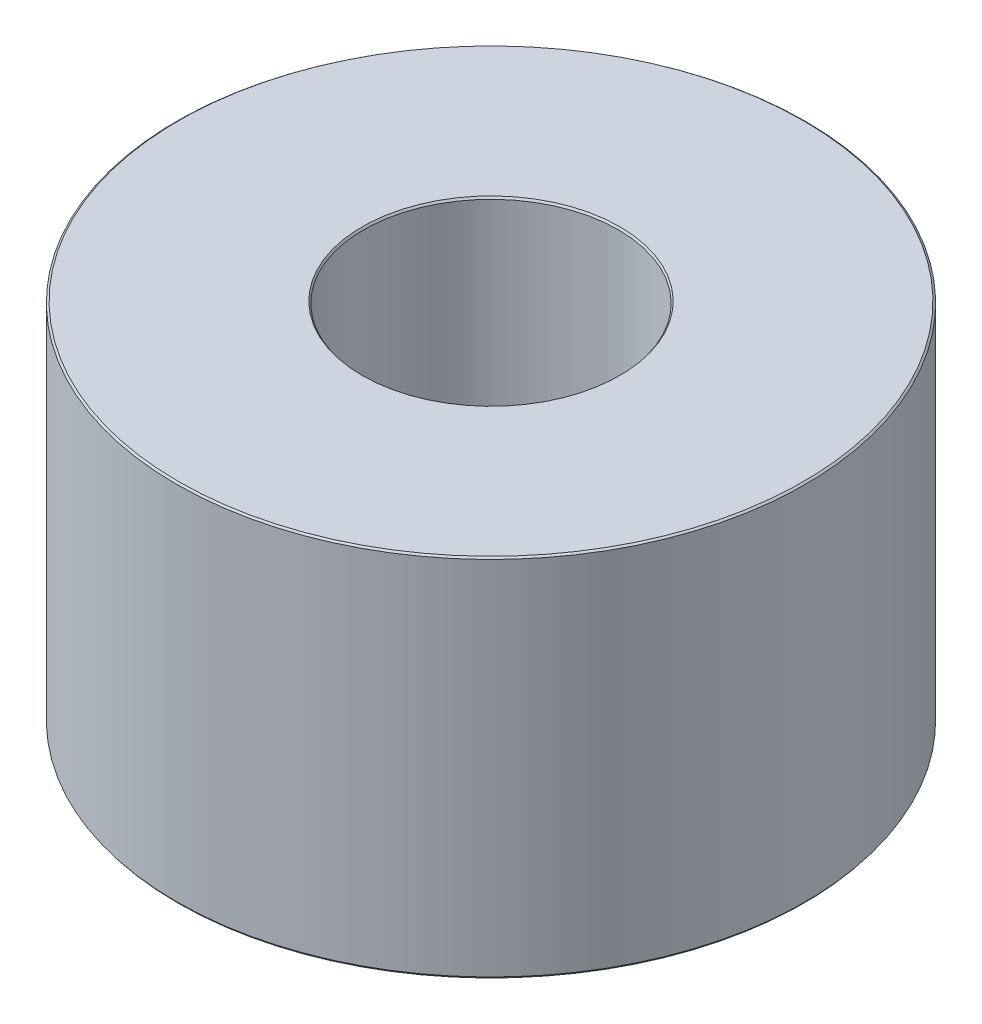
from build123d import *
from OCP.BRepFilletAPI import BRepFilletAPI_MakeChamfer

# Parameters (mm, degrees)
SKETCH1_R           = 47.5
BOSS_EXTRUDE1_DEPTH = 55.128628039
SKETCH2_R           = 19.250510028
CUT_EXTRUDE1_DEPTH  = 87.900320077
CHAMFER1_SIZE       = 0.215353887
CHAMFER1_SIZE2      = 0.288203318


with BuildPart() as part:
    # Sketch1 → Boss-Extrude1 (new body)
    with BuildSketch(Plane(origin=(0, 0, 0), x_dir=(1, 0, 0), z_dir=(0, 1, 0))):
        Circle(SKETCH1_R)
    extrude(amount=BOSS_EXTRUDE1_DEPTH)

    # Sketch2 → Cut-Extrude1 (cut, through all)
    with BuildSketch(Plane(origin=(0, 0, 0), x_dir=(1, 0, 0), z_dir=(0, 1, 0))):
        Circle(SKETCH2_R)
    extrude(amount=CUT_EXTRUDE1_DEPTH, mode=Mode.SUBTRACT)

    # Chamfer1: one chamfer whose edges measure the first distance from different faces: ONE call of the kernel's chamfer builder (chamfer() names one face for all edges)
    chamfer1_edges_1 = [part.edges().sort_by_distance(p)[0] for p in [
        (-19.250510028, 55.128628039, 0),
    ]]
    chamfer1_side_1 = [part.faces().sort_by_distance(p)[0] for p in [
        (-46.156497116, 55.128628039, 0),
    ]]
    chamfer1_edges_2 = [part.edges().sort_by_distance(p)[0] for p in [
        (-19.250510028, 0, 0),
    ]]
    chamfer1_side_2 = [part.faces().sort_by_distance(p)[0] for p in [
        (-19.250510028, 27.564314019, 0),
    ]]
    chamfer1_edges_3 = [part.edges().sort_by_distance(p)[0] for p in [
        (-47.5, 0, 0),
    ]]
    chamfer1_side_3 = [part.faces().sort_by_distance(p)[0] for p in [
        (-46.156497116, 0, 0),
    ]]
    chamfer1_edges_4 = [part.edges().sort_by_distance(p)[0] for p in [
        (-47.5, 55.128628039, 0),
    ]]
    chamfer1_side_4 = [part.faces().sort_by_distance(p)[0] for p in [
        (-47.5, 27.564314019, 0),
    ]]
    chamfer1 = BRepFilletAPI_MakeChamfer(part.part.solid().wrapped)
    for e in chamfer1_edges_1:
        chamfer1.Add(CHAMFER1_SIZE, CHAMFER1_SIZE2, e.wrapped, chamfer1_side_1[0].wrapped)  # the first distance lies on this face
    for e in chamfer1_edges_2:
        chamfer1.Add(CHAMFER1_SIZE, CHAMFER1_SIZE2, e.wrapped, chamfer1_side_2[0].wrapped)  # the first distance lies on this face
    for e in chamfer1_edges_3:
        chamfer1.Add(CHAMFER1_SIZE, CHAMFER1_SIZE2, e.wrapped, chamfer1_side_3[0].wrapped)  # the first distance lies on this face
    for e in chamfer1_edges_4:
        chamfer1.Add(CHAMFER1_SIZE, CHAMFER1_SIZE2, e.wrapped, chamfer1_side_4[0].wrapped)  # the first distance lies on this face
    add(Compound.cast(chamfer1.Shape()), mode=Mode.REPLACE)


solid = part.part
